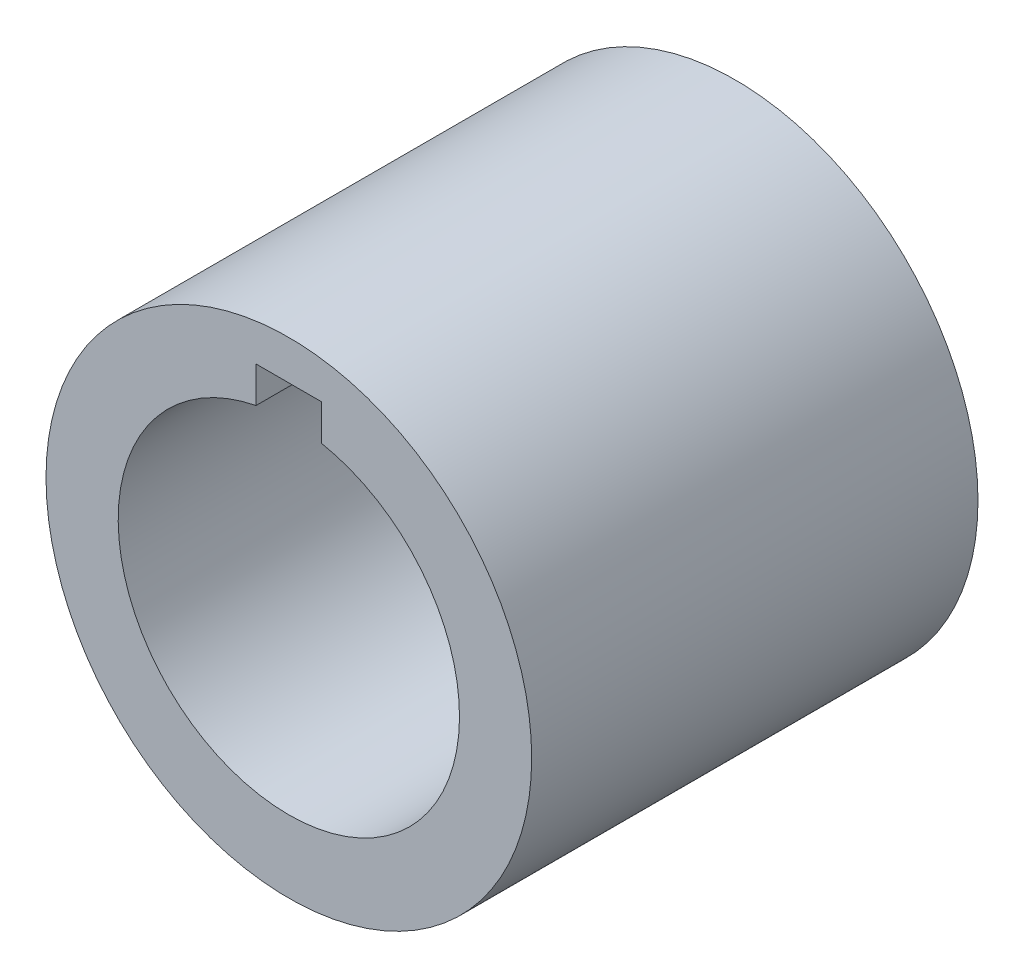
from build123d import *

# Parameters (mm, degrees)
SKETCH1_R           = 18.5
SKETCH1_R_2         = 13
BOSS_EXTRUDE1_DEPTH = 34
SKETCH2_W           = 5
SKETCH2_H           = 5
CUT_EXTRUDE1_DEPTH  = 25.5
FILLET2_R           = 2.5
FILLET3_R           = 2.5


with BuildPart() as part:
    # Sketch1 → Boss-Extrude1 (new body)
    with BuildSketch(Plane.XY):
        Circle(SKETCH1_R)
        Circle(SKETCH1_R_2, mode=Mode.SUBTRACT)
    extrude(amount=BOSS_EXTRUDE1_DEPTH)

    # Sketch2 → Cut-Extrude1 (cut)
    with BuildSketch(Plane.XY.offset(34)):
        with Locations((0, 13)):
            Rectangle(SKETCH2_W, SKETCH2_H)
    extrude(amount=-CUT_EXTRUDE1_DEPTH, mode=Mode.SUBTRACT)

    # Fillet2
    fillet2_edges = [part.edges().sort_by_distance(p)[0] for p in [
        (2.5, 14.128675411, 8.5),
    ]]
    fillet(fillet2_edges, radius=FILLET2_R)

    # Fillet3
    fillet3_edges = [part.edges().sort_by_distance(p)[0] for p in [
        (-2.5, 14.128675411, 8.5),
    ]]
    fillet(fillet3_edges, radius=FILLET3_R - 0.0001)  # a hair under: the kernel refuses the full size


solid = part.part
